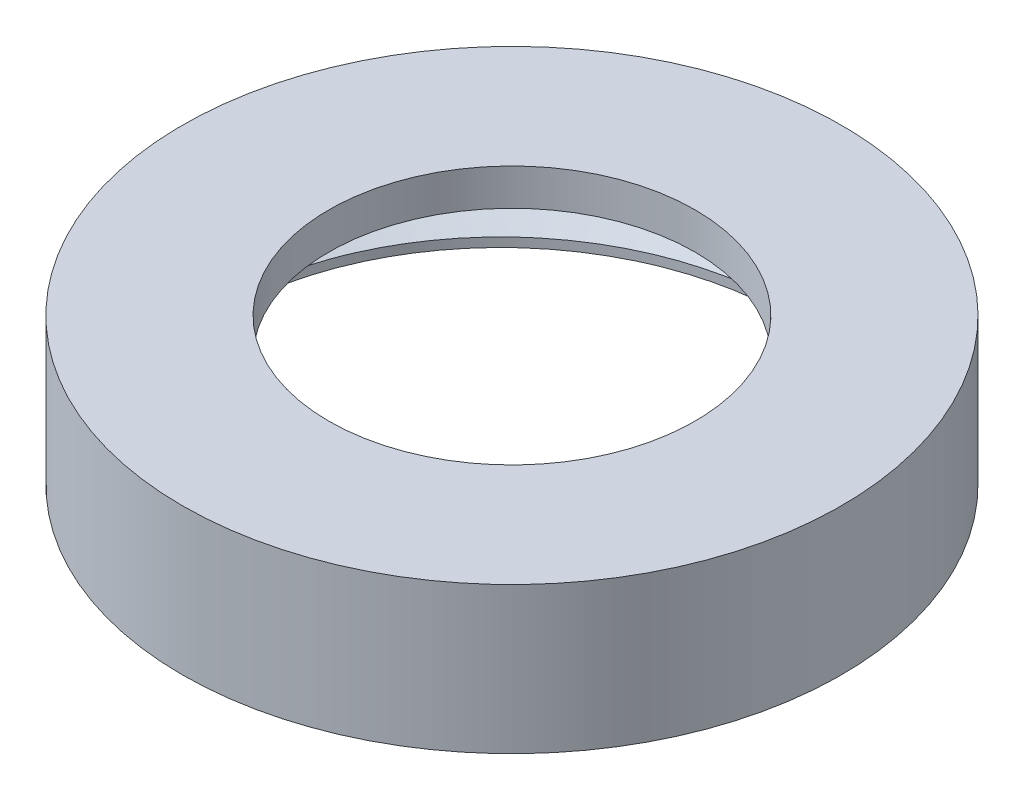
from build123d import *

# Parameters (mm, degrees)
SKETCH1_R           = 9
SKETCH1_R_2         = 7.75
BOSS_EXTRUDE1_DEPTH = 3
SKETCH2_R           = 9
SKETCH2_R_2         = 5
BOSS_EXTRUDE2_DEPTH = 1
THREAD2_PITCH       = 1
THREAD2_TO          = 4


with BuildPart() as part:
    # Sketch1 → Boss-Extrude1 (new body)
    with BuildSketch(Plane(origin=(0, 0, 0), x_dir=(1, 0, 0), z_dir=(0, 1, 0))):
        with Locations(Location((0, 0, 0), (0, 0, 270))):
            Circle(SKETCH1_R)
        with Locations(Location((0, 0, 0), (0, 0, 270))):
            Circle(SKETCH1_R_2, mode=Mode.SUBTRACT)
    extrude(amount=BOSS_EXTRUDE1_DEPTH)

    # Sketch2 → Boss-Extrude2 (add)
    with BuildSketch(Plane(origin=(0, 3, 0), x_dir=(1, 0, 0), z_dir=(0, 1, 0))):
        with Locations(Location((0, 0, 0), (0, 0, 270))):
            Circle(SKETCH2_R)
        with Locations(Location((0, 0, 0), (0, 0, 270))):
            Circle(SKETCH2_R_2, mode=Mode.SUBTRACT)
    extrude(amount=BOSS_EXTRUDE2_DEPTH)

    # Thread2: arcs per turn and ends read off the stored shape
    # Thread2: the profile of Thread Profile2 profile screwed along a right-hand helix through 4 turns, 8 arcs to a turn; built about Z, then put on its axis
    thread2_z = Axis((0, 0, 0), (0, 0, 1))
    thread2_corners = [(7.7497, 0, -0.000173205), (8.291265875, 0, 0.312499999), (8.291265875, 0, 0.437499999), (7.7497, 0, 0.750173202)]
    with BuildLine(mode=Mode.PRIVATE) as thread2_profile:
        Line(thread2_corners[0], thread2_corners[1])
        Line(thread2_corners[1], thread2_corners[2])
        Line(thread2_corners[2], thread2_corners[3])
        Line(thread2_corners[3], thread2_corners[0])
    thread2_cap = Face(thread2_profile.wire())
    thread2_turn_angles = [0, 22.5, 45, 67.5, 90, 112.5, 135, 157.5, 180, 202.5, 225, 247.5, 270, 292.5, 315, 337.5, 360]
    thread2_turn_weights = [1, 0.9238795325112867, 1, 0.9238795325112867, 1, 0.9238795325112867, 1, 0.9238795325112867, 1, 0.9238795325112867, 1, 0.9238795325112867, 1, 0.9238795325112867, 1, 0.9238795325112867, 1]
    thread2_turn_rails = [Edge.make_bspline([Vector(p[0], p[1], 0).rotate(thread2_z, thread2_turn_angles[k]) / thread2_turn_weights[k] + Vector(0, 0, p[2] + THREAD2_PITCH * thread2_turn_angles[k] / 360) for k in range(17)], [0, 0, 0, 1, 1, 2, 2, 3, 3, 4, 4, 5, 5, 6, 6, 7, 7, 8, 8, 8], 2, thread2_turn_weights) for p in thread2_corners]
    thread2_turn_sides = [Face.make_surface_from_curves(thread2_turn_rails[p[0]], thread2_turn_rails[p[1]]) for p in [(0, 1), (1, 2), (2, 3), (3, 0)]]
    thread2 = Plane(origin=(0, -1, 0), x_dir=(1, 0, 0), z_dir=(0, 1, 0)) * split(Solid(Shell([*[p.moved(Location((0, 0, THREAD2_PITCH * i))) for i in range(4) for p in thread2_turn_sides], thread2_cap, thread2_cap.rotate(thread2_z, 1440).moved(Location((0, 0, THREAD2_PITCH * 1440 / 360)))])), bisect_by=Plane.XY.offset(THREAD2_TO), keep=Keep.BOTTOM, mode=Mode.PRIVATE)
    add(thread2, mode=Mode.SUBTRACT)


solid = part.part
